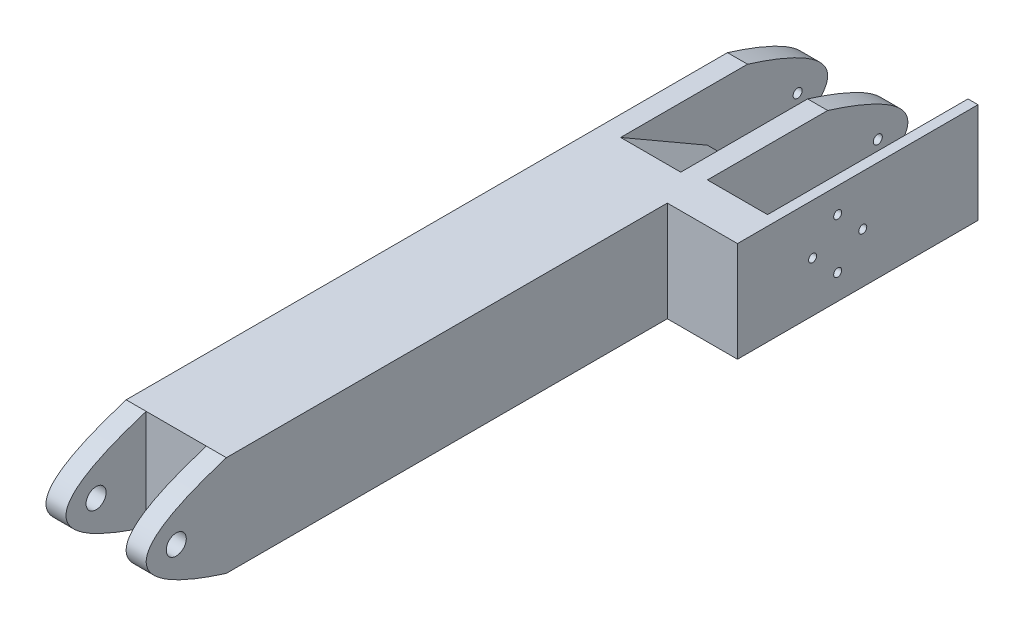
from build123d import *

# Parameters (mm, degrees)
SKETCH1_R               = 5
SKETCH1_R_2             = 2.25
BOSS_EXTRUDE1_DEPTH     = 50
CUT_EXTRUDE1_DEPTH      = 52
CUT_EXTRUDE1_DEPTH_BACK = 35
SKETCH2_W               = 30
SKETCH2_H               = 60
SKETCH3_W               = 30
SKETCH3_H               = 40
CUT_EXTRUDE2_DEPTH      = 52
CUT_EXTRUDE3_START      = -10
CUT_EXTRUDE3_DEPTH      = 30
CUT_EXTRUDE4_START      = -10
CUT_EXTRUDE4_DEPTH      = 30
BOSS_EXTRUDE2_DEPTH     = 50
SKETCH8_R               = 2
CUT_EXTRUDE5_DEPTH      = 10


with BuildPart() as part:
    # Sketch1 → Boss-Extrude1 (new body)
    with BuildSketch(Plane(origin=(0, 0, 0), x_dir=(0, 0, -1), z_dir=(1, 0, 0))):
        with BuildLine():
            Line((-255.87149894, 42.046001407), (44.12850106, 42.046001407))
            add(Edge.make_bspline(
                [(44.12850106, 42.046001407), (124.12850106, 17.046001407), (44.12850106, -7.953998593)],
                knots=[0, 0, 0, 1, 1, 1], degree=2))
            Line((44.12850106, -7.953998593), (-255.87149894, -7.953998593))
            add(Edge.make_bspline(
                [(-255.87149894, 42.046001407), (-335.87149894, 17.046001407), (-255.87149894, -7.953998593)],
                knots=[0, 0, 0, 1, 1, 1], degree=2))
        make_face()
        with Locations((-280.87149894, 17.046001407)):
            Circle(SKETCH1_R, mode=Mode.SUBTRACT)
        with Locations((69.12850106, 17.046001407)):
            Circle(SKETCH1_R_2, mode=Mode.SUBTRACT)
    extrude(amount=BOSS_EXTRUDE1_DEPTH)

    # Sketch2 → Cut-Extrude1 (cut, two sides: drawn at the far end of the back side and taken through both)
    with BuildSketch(Plane(origin=(0, 0, 0), x_dir=(1, 0, 0), z_dir=(0, 1, 0)).offset(-CUT_EXTRUDE1_DEPTH_BACK)):
        with Locations((25, 54.12850106)):
            Rectangle(SKETCH2_W, SKETCH2_H)
    extrude(amount=CUT_EXTRUDE1_DEPTH + CUT_EXTRUDE1_DEPTH_BACK, mode=Mode.SUBTRACT)

    # Sketch3 → Cut-Extrude2 (cut)
    with BuildSketch(Plane.XZ.offset(7.953998593)):
        with Locations((25, 275.87149894)):
            Rectangle(SKETCH3_W, SKETCH3_H)
    extrude(amount=-CUT_EXTRUDE2_DEPTH, mode=Mode.SUBTRACT)

    # Sketch4 → Cut-Extrude3 (cut)
    with BuildSketch(Plane.ZY.offset(CUT_EXTRUDE3_START)):
        Polygon((-24.12850106, 17.046001407), (-24.12850106, 42.046001407), (19.172769129, 42.046001407), align=None)
    extrude(amount=-CUT_EXTRUDE3_DEPTH, mode=Mode.SUBTRACT)

    # Sketch5 → Cut-Extrude4 (cut)
    with BuildSketch(Plane.ZY.offset(CUT_EXTRUDE4_START)):
        Polygon((-24.12850106, -7.953998593), (-24.12850106, 17.046001407), (19.172769129, -7.953998593), align=None)
    extrude(amount=-CUT_EXTRUDE4_DEPTH, mode=Mode.SUBTRACT)

    # Sketch6 → Boss-Extrude2 (add)
    with BuildSketch(Plane(origin=(0, 42.046001407, 0), x_dir=(1, 0, 0), z_dir=(0, 1, 0))):
        Polygon((50, -35.87149894), (85, -35.87149894), (85, 84.12850106), (80, 84.12850106), (80, -15.87149894), (50, -15.87149894), align=None)
    extrude(amount=-BOSS_EXTRUDE2_DEPTH)

    # Sketch8 → Cut-Extrude5 (cut)
    with BuildSketch(Plane(origin=(85, 0, 0), x_dir=(0, 0, -1), z_dir=(1, 0, 0))):
        with Locations((14.12850106, 29.546001407)):
            Circle(SKETCH8_R)
        with Locations((26.62850106, 17.046001407)):
            Circle(SKETCH8_R)
        with Locations((14.12850106, 4.546001407)):
            Circle(SKETCH8_R)
        with Locations((1.62850106, 17.046001407)):
            Circle(SKETCH8_R)
    extrude(amount=-CUT_EXTRUDE5_DEPTH, mode=Mode.SUBTRACT)


solid = part.part
